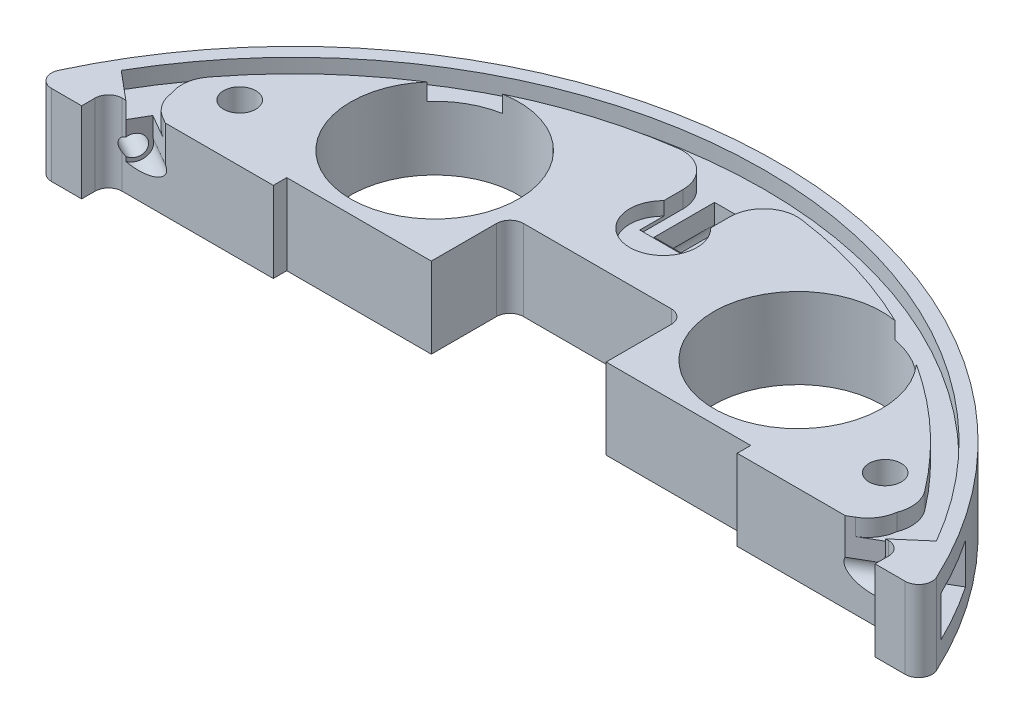
from build123d import *

# Parameters (mm, degrees)
BOSS_EXTRUDE1_DEPTH  = 6
SOLENOID_PLACEMENT_W = 38
SOLENOID_PLACEMENT_H = 64
CUT_EXTRUDE1_DEPTH   = 103.528044944
CUT_EXTRUDE4_DEPTH   = 103.528044944
SKETCH5_R            = 12.5
CUT_EXTRUDE5_DEPTH   = 103.528044944
SKETCH6_R            = 2.4
CUT_EXTRUDE6_DEPTH   = 103.528044944
CUT_EXTRUDE3_DEPTH   = 103.528044944
FILLET1_R            = 2
CUT_EXTRUDE7_DEPTH   = 3
SKETCH10_R           = 5
CUT_EXTRUDE9_DEPTH   = 2
SKETCH11_W           = 69
SKETCH11_H           = 67
CUT_EXTRUDE10_DEPTH  = 99.059529102
SKETCH13_R           = 1.55
CUT_EXTRUDE11_DEPTH  = 4.2
SKETCH14_R           = 2.1
CUT_EXTRUDE12_DEPTH  = 9
SKETCH15_W           = 4
SKETCH15_H           = 10.882727098
CUT_EXTRUDE13_DEPTH  = 9
CIRPATTERN1_COUNT    = 3
CIRPATTERN1_ANGLE    = 120
CUT_EXTRUDE14_DEPTH  = 2.5
FILLET2_R            = 5


with BuildPart() as part:
    # Sketch1 → Boss-Extrude1 (new, symmetric)
    with BuildSketch(Plane(origin=(0, 0, 0), x_dir=(1, 0, 0), z_dir=(0, 1, 0))):
        with BuildLine():
            ThreePointArc((36.224522061, -62.223661106), (0, 72), (-36.224522061, -62.223661106))
            ThreePointArc((-36.224522061, -62.223661106), (-32.797800029, -62.818856853), (-29.811944095, -61.035223988))
            ThreePointArc((-29.811944095, -61.035223988), (0, -46.75), (29.811944095, -61.035223988))
            ThreePointArc((29.811944095, -61.035223988), (32.797800029, -62.818856853), (36.224522061, -62.223661106))
        make_face()
    extrude(amount=BOSS_EXTRUDE1_DEPTH, both=True)

    # solenoid placement → Cut-Extrude1 (cut, through all)
    with BuildSketch(Plane(origin=(0, 6, 0), x_dir=(1, 0, 0), z_dir=(0, 1, 0))):
        with Locations((0, -4)):
            Rectangle(SOLENOID_PLACEMENT_W, SOLENOID_PLACEMENT_H)
    extrude(amount=-CUT_EXTRUDE1_DEPTH, mode=Mode.SUBTRACT)

    # Sketch4 → Cut-Extrude4 (cut, through all)
    with BuildSketch(Plane(origin=(0, 6, 0), x_dir=(1, 0, 0), z_dir=(0, 1, 0))):
        with BuildLine():
            Line((-13, 28), (13, 28))
            Line((13, 28), (13, 43.2))
            ThreePointArc((13, 43.2), (12.414213562, 44.614213562), (11, 45.2))
            Line((11, 45.2), (-11, 45.2))
            ThreePointArc((-11, 45.2), (-12.414213562, 44.614213562), (-13, 43.2))
            Line((-13, 43.2), (-13, 28))
        make_face()
    extrude(amount=-CUT_EXTRUDE4_DEPTH, mode=Mode.SUBTRACT)

    # Sketch5 → Cut-Extrude5 (cut, through all)
    with BuildSketch(Plane(origin=(0, 6, 0), x_dir=(1, 0, 0), z_dir=(0, 1, 0))):
        with Locations(Location((27, 48, 0), (0, 0, 90))):
            Circle(SKETCH5_R)
        with Locations(Location((-27, 48, 0), (0, 0, 270))):
            Circle(SKETCH5_R)
    extrude(amount=-CUT_EXTRUDE5_DEPTH, mode=Mode.SUBTRACT)

    # Sketch6 → Cut-Extrude6 (cut, through all)
    with BuildSketch(Plane(origin=(0, 6, 0), x_dir=(1, 0, 0), z_dir=(0, 1, 0))):
        with Locations(Location((48, 40, 0), (0, 0, 90))):
            Circle(SKETCH6_R)
        with Locations(Location((-48, 40, 0), (0, 0, 270))):
            Circle(SKETCH6_R)
    extrude(amount=-CUT_EXTRUDE6_DEPTH, mode=Mode.SUBTRACT)

    # Sketch3 → Cut-Extrude3 (cut, through all)
    with BuildSketch(Plane(origin=(0, 6, 0), x_dir=(1, 0, 0), z_dir=(0, 1, 0))):
        Polygon((-72, -31.5), (-72, 27.5), (-59, 27.5), (-59, 31.5), (0, 31.5), (59, 31.5), (59, 27.5), (72, 27.5), (72, -31.5), (72, -101.646422462), (-72, -101.646422462), align=None)
    extrude(amount=-CUT_EXTRUDE3_DEPTH, mode=Mode.SUBTRACT)

    # Fillet1
    fillet1_edges = [part.edges().sort_by_distance(p)[0] for p in [
        (-66.541340534, 0, -27.5),
        (66.541340534, 0, -27.5),
        (-59, 0, -31.5),
        (59, 0, -31.5),
    ]]
    fillet(fillet1_edges, radius=FILLET1_R)

    # Sketch8 → Cut-Extrude7 (cut, symmetric)
    with BuildSketch(Plane(origin=(0, 0, 0), x_dir=(1, 0, 0), z_dir=(0, 1, 0))):
        with BuildLine():
            Line((5, 71.826179071), (5, 68.826179071))
            Line((5, 68.826179071), (-5, 68.826179071))
            Line((-5, 68.826179071), (-5, 71.826179071))
            ThreePointArc((-5, 71.826179071), (0, 72), (5, 71.826179071))
        make_face()
        with BuildLine():
            Line((64.703295733, 31.582962517), (62.105219521, 30.082962517))
            Line((62.105219521, 30.082962517), (57.105219521, 38.743216555))
            Line((57.105219521, 38.743216555), (59.703295733, 40.243216555))
            ThreePointArc((59.703295733, 40.243216555), (62.353829072, 36), (64.703295733, 31.582962517))
        make_face()
        with BuildLine():
            Line((-59.703295733, 40.243216555), (-57.105219521, 38.743216555))
            Line((-57.105219521, 38.743216555), (-62.105219521, 30.082962517))
            Line((-62.105219521, 30.082962517), (-64.703295733, 31.582962517))
            ThreePointArc((-64.703295733, 31.582962517), (-62.353829072, 36), (-59.703295733, 40.243216555))
        make_face()
    extrude(amount=CUT_EXTRUDE7_DEPTH, both=True, mode=Mode.SUBTRACT)

    # Sketch10 → Cut-Extrude9 (cut)
    with BuildSketch(Plane(origin=(0, 6, 0), x_dir=(1, 0, 0), z_dir=(0, 1, 0))):
        with Locations(Location((0, 55, 0), (0, 0, 270))):
            Circle(SKETCH10_R)
    extrude(amount=-CUT_EXTRUDE9_DEPTH, mode=Mode.SUBTRACT)

    # Sketch11 → Cut-Extrude10 (cut, through all)
    with BuildSketch(Plane(origin=(0, 6, 0), x_dir=(1, 0, 0), z_dir=(0, 1, 0))):
        Rectangle(SKETCH11_W, SKETCH11_H)
    extrude(amount=-CUT_EXTRUDE10_DEPTH, mode=Mode.SUBTRACT)

    # Sketch13 → Cut-Extrude11 (cut)
    with BuildSketch(Plane(origin=(-59.605219521, 0, -34.413089536), x_dir=(-0.5000000000000001, 0, 0.8660254037844386), z_dir=(-0.8660254037844386, 0, -0.5000000000000001))):
        Circle(SKETCH13_R)
    cut_extrude11 = extrude(amount=-CUT_EXTRUDE11_DEPTH, mode=Mode.SUBTRACT)

    # Sketch14 → Cut-Extrude12 (cut)
    with BuildSketch(Plane(origin=(-55.967912825, 0, -32.313089536), x_dir=(-0.5000000000000001, 0, 0.8660254037844386), z_dir=(-0.8660254037844386, 0, -0.5000000000000001))):
        Circle(SKETCH14_R)
    cut_extrude12 = extrude(amount=-CUT_EXTRUDE12_DEPTH, mode=Mode.SUBTRACT)

    # Sketch15 → Cut-Extrude13 (cut)
    with BuildSketch(Plane(origin=(-55.967912825, 0, -32.313089536), x_dir=(0.5000000000000001, 0, -0.8660254037844386), z_dir=(0.8660254037844386, 0, 0.5000000000000001))):
        with Locations((0, 5.441363549)):
            Rectangle(SKETCH15_W, SKETCH15_H)
    cut_extrude13 = extrude(amount=CUT_EXTRUDE13_DEPTH, mode=Mode.SUBTRACT)

    # CirPattern1: Cut-Extrude11, Cut-Extrude12, Cut-Extrude13 ×3 about axis
    cirpattern1_axis = Axis((0, 0, 0), (0, -1, 0))
    add([cut_extrude11.rotate(cirpattern1_axis, i * CIRPATTERN1_ANGLE / (CIRPATTERN1_COUNT - 1)) for i in range(1, CIRPATTERN1_COUNT)], mode=Mode.SUBTRACT)
    add([cut_extrude12.rotate(cirpattern1_axis, i * CIRPATTERN1_ANGLE / (CIRPATTERN1_COUNT - 1)) for i in range(1, CIRPATTERN1_COUNT)], mode=Mode.SUBTRACT)
    add([cut_extrude13.rotate(cirpattern1_axis, i * CIRPATTERN1_ANGLE / (CIRPATTERN1_COUNT - 1)) for i in range(1, CIRPATTERN1_COUNT)], mode=Mode.SUBTRACT)

    # Sketch16 → Cut-Extrude14 (cut)
    with BuildSketch(Plane(origin=(0, 6, 0), x_dir=(1, 0, 0), z_dir=(0, 1, 0))):
        with BuildLine():
            Line((-56.437350288, 31.5), (-60.621778265, 35))
            ThreePointArc((-60.621778265, 35), (0, 70), (60.621778265, 35))
            Line((60.621778265, 35), (56.477458213, 31.430531036))
            Line((56.477458213, 31.430531036), (53.977458213, 35.760658055))
            Line((53.977458213, 35.760658055), (55.69643641, 37.241199916))
            ThreePointArc((55.69643641, 37.241199916), (33.107279951, 58.248673927), (3.5, 66.908519637))
            Line((3.5, 66.908519637), (3.5, 55))
            Line((3.5, 55), (-3.5, 55))
            Line((-3.5, 55), (-3.5, 66.908519637))
            ThreePointArc((-3.5, 66.908519637), (-33.087061005, 58.260161295), (-55.670571638, 37.279853185))
            Line((-55.670571638, 37.279853185), (-53.937350288, 35.830127019))
            Line((-53.937350288, 35.830127019), (-56.437350288, 31.5))
        make_face()
    extrude(amount=-CUT_EXTRUDE14_DEPTH, mode=Mode.SUBTRACT)

    # Fillet2
    # the kernel refuses this fillet: 5 mm, written as the material it takes off along each edge
    with BuildSketch(Plane(origin=(55.69643641, 16.329932335, -37.241199916), x_dir=(-0.5812078308679164, 0, -0.8137551581021232), z_dir=(0, -1, 0))) as fillet2_piece_1:
        with BuildLine():
            CenterArc((3.97779484, -4.997622346), FILLET2_R, 88.232969076, 58.560507528)
            Line((-0.205714987, -2.259329899), (-0.289385184, -2.20456405))
            ThreePointArc((-0.289385184, -2.20456405), (-0.202445536, -1.120597326), (-0.099588042, 0.009067624))
            Line((-0.099588042, 0.009067624), (-0.003083562, 0.099952447))
            ThreePointArc((-0.003083562, 0.099952447), (2.065986467, 0.131860561), (4.135056496, 0.099952447))
            Line((4.135056496, 0.099952447), (4.131972934, 0))
        make_face()
    extrude(amount=12.829932335, mode=Mode.SUBTRACT)
    with BuildSketch(Plane(origin=(-3.5, 20.277950053, -66.908519637), x_dir=(-0.9955007283712978, 0, 0.09475389074975102), z_dir=(0, -1, 0))) as fillet2_piece_2:
        with BuildLine():
            CenterArc((5.498076289, -4.995456616), FILLET2_R, 87.557271181, 97.879883712)
            Line((0.520572647, -5.469226069), (0.421022574, -5.478701459))
            Line((0.421022574, -5.478701459), (-0.099550073, -0.009475389))
            Line((-0.099550073, -0.009475389), (-0.004262075, 0.099909132))
            ThreePointArc((-0.004262075, 0.099909132), (2.855590011, 0.16088135), (5.715442096, 0.099909132))
            Line((5.715442096, 0.099909132), (5.711180021, 0))
        make_face()
    extrude(amount=16.777950053, mode=Mode.SUBTRACT)
    with BuildSketch(Plane(origin=(3.5, 20.277950053, -66.908519637), x_dir=(0.9955007283712978, 0, 0.09475389074975099), z_dir=(0, -1, 0))) as fillet2_piece_3:
        with BuildLine():
            CenterArc((5.498076289, 4.995456616), FILLET2_R, 174.562845107, 97.879883712)
            Line((0.520572647, 5.469226069), (0.421022574, 5.478701459))
            Line((0.421022574, 5.478701459), (-0.099550073, 0.009475389))
            Line((-0.099550073, 0.009475389), (-0.004262075, -0.099909132))
            ThreePointArc((-0.004262075, -0.099909132), (2.855590011, -0.16088135), (5.715442096, -0.099909132))
            Line((5.715442096, -0.099909132), (5.711180021, 0))
        make_face()
    extrude(amount=16.777950053, mode=Mode.SUBTRACT)
    with BuildSketch(Plane(origin=(-55.670571638, 16.411618265, -37.279853185), x_dir=(0.581970971434149, 0, -0.8132095599585589), z_dir=(0, -1, 0))) as fillet2_piece_4:
        with BuildLine():
            CenterArc((4.009250019, 4.997584585), FILLET2_R, 213.290400287, 58.490608258)
            Line((-0.170246664, 2.253170717), (-0.253836598, 2.198282439))
            ThreePointArc((-0.253836598, 2.198282439), (-0.184839093, 1.119050965), (-0.099715761, -0.007534394))
            Line((-0.099715761, -0.007534394), (-0.003107946, -0.099951692))
            ThreePointArc((-0.003107946, -0.099951692), (2.082323653, -0.132366563), (4.167755252, -0.099951692))
            Line((4.167755252, -0.099951692), (4.164647306, 0))
        make_face()
    extrude(amount=12.911618265, mode=Mode.SUBTRACT)
    with BuildSketch(Plane(origin=(54.967912825, 15.964026198, -34.045140343), x_dir=(-0.8660254037844403, 0, 0.4999999999999973), z_dir=(0, -1, 0))) as fillet2_piece_5:
        with BuildLine():
            CenterArc((3.985610479, 5), FILLET2_R, 217.143845078, 52.856154922)
            Line((0, 1.980909225), (-0.07971221, 1.92052741))
            ThreePointArc((-0.07971221, 1.92052741), (-0.1, 0.990454613), (-0.1, 0))
            Line((-0.1, 0), (0, -0.1))
            Line((0, -0.1), (3.985610479, -0.1))
            Line((3.985610479, -0.1), (3.985610479, 0))
        make_face()
    extrude(amount=12.464026198, mode=Mode.SUBTRACT)
    with BuildSketch(Plane(origin=(-54.967912825, 3.5, -34.045140343), x_dir=(0.8660254037844386, 0, 0.5), z_dir=(0, 1, 0))) as fillet2_piece_6:
        with BuildLine():
            CenterArc((4.04512227, 5), FILLET2_R, 215.999272853, 54.000727147)
            Line((0, 2.061125075), (-0.080902445, 2.002347577))
            ThreePointArc((-0.080902445, 2.002347577), (-0.1, 1.030562538), (-0.1, 0))
            Line((-0.1, 0), (0, -0.1))
            Line((0, -0.1), (4.04512227, -0.1))
            Line((4.04512227, -0.1), (4.04512227, 0))
        make_face()
    extrude(amount=12.612805674, mode=Mode.SUBTRACT)


solid = part.part
